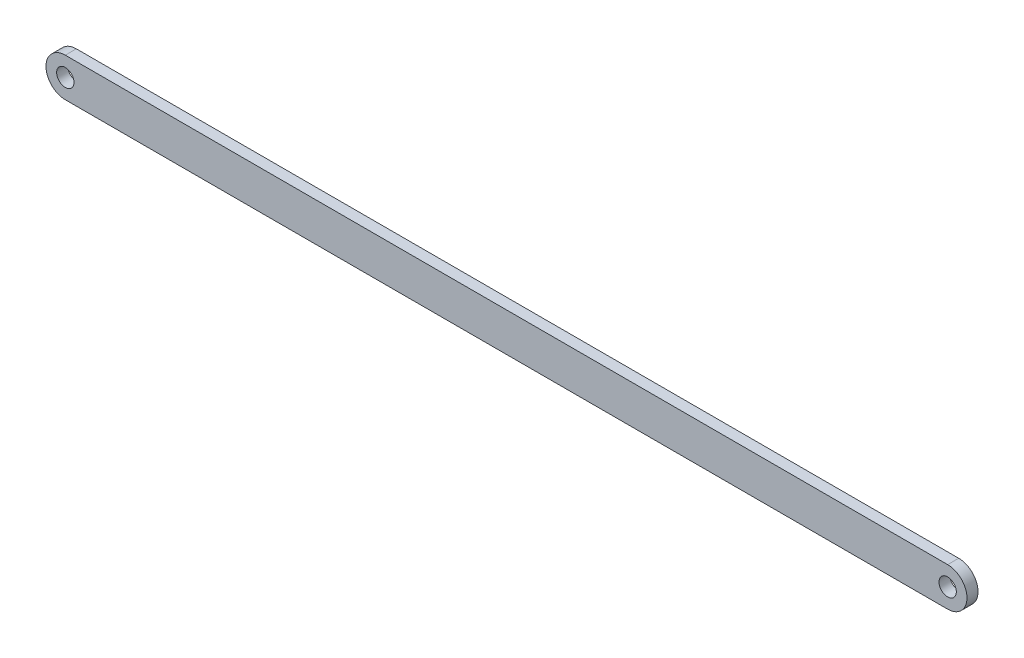
from build123d import *

# Parameters (mm, degrees)
SKETCH1_R           = 1.9939
BOSS_EXTRUDE1_DEPTH = 2.54


with BuildPart() as part:
    # Sketch1 → Boss-Extrude1 (new body)
    with BuildSketch(Plane.XY):
        with BuildLine():
            Line((101.6, 4.445), (-101.6, 4.445))
            ThreePointArc((-101.6, 4.445), (-106.045, 0), (-101.6, -4.445))
            Line((-101.6, -4.445), (101.6, -4.445))
            ThreePointArc((101.6, -4.445), (106.045, 0), (101.6, 4.445))
        make_face()
        with Locations((-101.6, 0)):
            Circle(SKETCH1_R, mode=Mode.SUBTRACT)
        with Locations((101.6, 0)):
            Circle(SKETCH1_R, mode=Mode.SUBTRACT)
    extrude(amount=BOSS_EXTRUDE1_DEPTH)


solid = part.part
